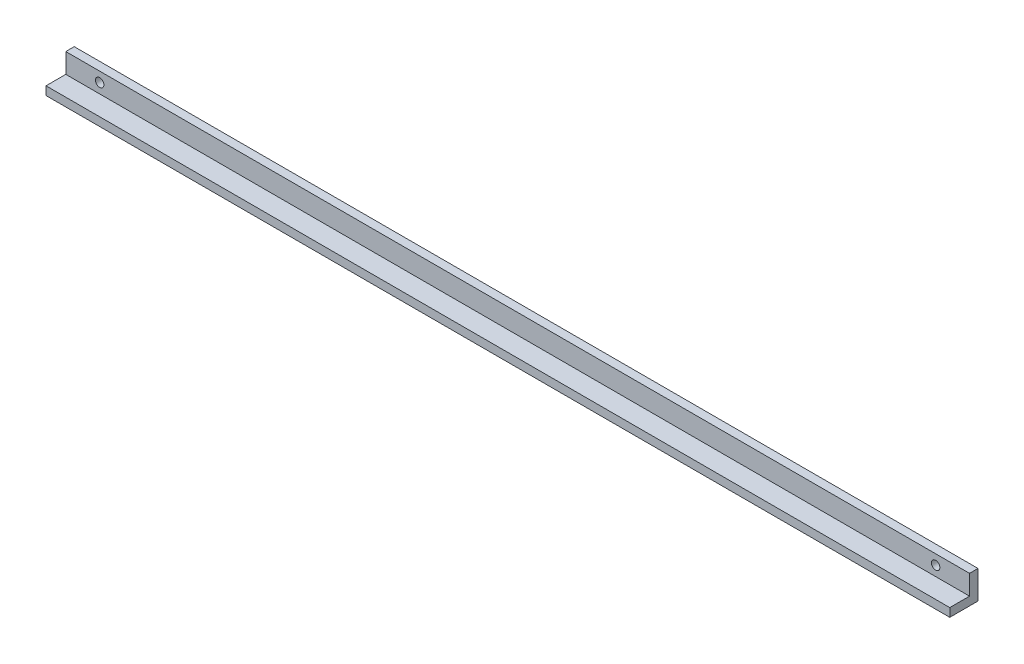
from build123d import *

# Parameters (mm, degrees)
EXTRUDE_1_DEPTH     = 320
SKETCH_2_R          = 1.5
CUT_EXTRUDE_1_DEPTH = 321.232727871


with BuildPart() as part:
    # Эскиз1 → Бобышка-Вытянуть1 (new body)
    with BuildSketch(Plane(origin=(0, 0, 0), x_dir=(0, 0, -1), z_dir=(1, 0, 0))):
        Polygon((0, 0), (-10, 0), (-10, 3), (-3, 3), (-3, 10), (0, 10), align=None)
    extrude(amount=EXTRUDE_1_DEPTH)

    # Эскиз2 → Вырез-Вытянуть1 (cut, through all)
    with BuildSketch(Plane.XY.offset(3)):
        with Locations((12, 6.5)):
            Circle(SKETCH_2_R)
        with Locations((308, 6.5)):
            Circle(SKETCH_2_R)
    extrude(amount=-CUT_EXTRUDE_1_DEPTH, mode=Mode.SUBTRACT)


solid = part.part
